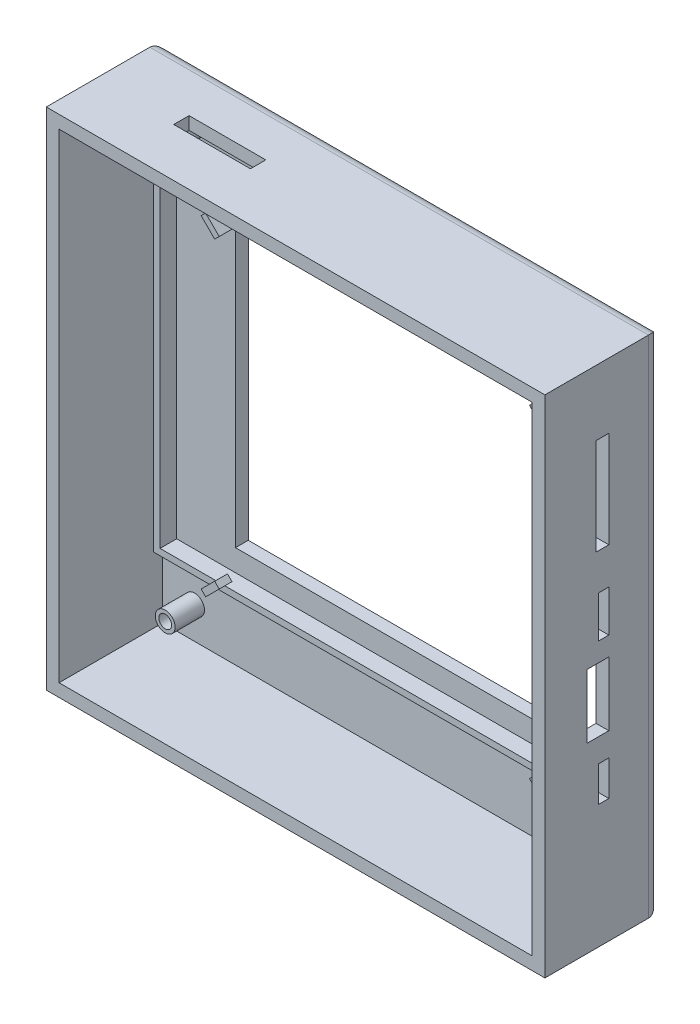
from build123d import *

# Parameters (mm, degrees)
SKETCH_876_W           = 78
SKETCH_876_H           = 79
EXTRUDE_1660_DEPTH     = 18.2
SKETCH_1708_W          = 74.00014986
SKETCH_1708_H          = 75.0001524
SKETCH_1708_W_2        = 69.2
SKETCH_1708_H_2        = 50
SKETCH_1708_W_3        = 57.6
SKETCH_1708_H_3        = 43.2
LCD_DEPTH              = 2
LCD_2_OUTLINE_W        = 71.5
LCD_2_OUTLINE_H        = 52
LCD_2_OUTLINE_W_2      = 69.5
LCD_2_OUTLINE_H_2      = 50
LCD_2_DEPTH            = 2.6
LCD_3_DEPTH            = 2
SKETCH_9_R             = 1.55
SKETCH_9_R_2           = 1.00000254
PCB_DEPTH              = 4.6
USB_START              = 74.00015
SKETCH_11_W            = 1.6
SKETCH_11_H            = 5.5
SKETCH_11_W_2          = 3.4
SKETCH_11_H_2          = 10
SKETCH_11_W_3          = 2
SKETCH_11_H_3          = 15.11
SKETCH_11_H_4          = 6.51
USB_DEPTH              = 1.999925
CUT_EXTRUDE_7042_REACH = 91.005
SKETCH_12_W            = 12
SKETCH_12_H            = 2.4
FILLET_1_R             = 2


# Read off the part's stored shape, not the designer's step: LCD边框
with BuildPart() as part:
    # Sketch 876 → Extrude 1660 (new body)
    with BuildSketch(Plane.XY):
        with Locations((1.76392246, -1.007858704)):
            Rectangle(SKETCH_876_W, SKETCH_876_H)
        Polygon((-17.23611691, -38.507858704), (-14.23610929, -38.507858704), (38.76399739, -38.507858704), (38.76399739, -20.507823144), (38.76399739, 15.492250516), (38.76399739, 36.492293696), (-35.23615247, 36.492293696), (-35.23615247, -38.507858704), align=None, mode=Mode.SUBTRACT)
    extrude(amount=-EXTRUDE_1660_DEPTH)

    # Sketch 1708 → LCD (add)
    # profile 1 of 2: a face of its own
    with BuildSketch(Plane(origin=(0, 0, -18.2), x_dir=(-1, 0, 0), z_dir=(0, 0, -1))):
        with Locations((-1.76392246, -1.007782504)):
            Rectangle(SKETCH_1708_W, SKETCH_1708_H)
        with Locations((-1.76392246, -1.007858704)):
            Rectangle(SKETCH_1708_W_2, SKETCH_1708_H_2, mode=Mode.SUBTRACT)
    # profile 2 of 2: a face of its own
    with BuildSketch(Plane(origin=(0, 0, -18.2), x_dir=(-1, 0, 0), z_dir=(0, 0, -1))):
        with Locations((-1.76392246, -1.007858704)):
            Rectangle(SKETCH_1708_W_2, SKETCH_1708_H_2)
        with Locations((-4.96392246, -1.007858704)):
            Rectangle(SKETCH_1708_W_3, SKETCH_1708_H_3, mode=Mode.SUBTRACT)
    extrude(amount=-LCD_DEPTH)

    # LCD 2 outline → LCD 2 (add)
    with BuildSketch(Plane.XY.offset(-16.2)):
        with Locations((1.71392246, -1.007858704)):
            Rectangle(LCD_2_OUTLINE_W, LCD_2_OUTLINE_H)
        with Locations((1.71392246, -1.007858704)):
            Rectangle(LCD_2_OUTLINE_W_2, LCD_2_OUTLINE_H_2, mode=Mode.SUBTRACT)
    extrude(amount=LCD_2_DEPTH)

    # 草图7 → LCD 3 (add)
    with BuildSketch(Plane.XY.offset(-13.6)):
        Polygon((-23.904159925, -27.007858704), (-21.782839581, -24.886538361), (-22.489946362, -24.17943158), (-24.611266706, -26.300751923), align=None)
        Polygon((27.461068732, -27.007858704), (29.582389075, -24.886538361), (28.875282294, -24.17943158), (26.75396195, -26.300751923), align=None)
        Polygon((26.75396195, 24.285034514), (28.875282294, 22.163714171), (29.582389075, 22.870820952), (27.461068732, 24.992141296), align=None)
        Polygon((-24.611266706, 24.285034514), (-22.489946362, 22.163714171), (-21.782839581, 22.870820952), (-23.904159925, 24.992141296), align=None)
    extrude(amount=LCD_3_DEPTH)

    # 草图9 → PCB螺丝位 (add)
    # profile 1 of 4: a face of its own
    with BuildSketch(Plane.XY.offset(-16.2)):
        with Locations(Location((-30.179759278, 31.492141296, 0), (0, 0, 180))):
            Circle(SKETCH_9_R)
        with Locations(Location((-30.179759278, 31.492141296, 0), (0, 0, 180))):
            Circle(SKETCH_9_R_2, mode=Mode.SUBTRACT)
    # profile 2 of 4: a face of its own
    with BuildSketch(Plane.XY.offset(-16.2)):
        with Locations(Location((33.76398723, 31.492283536, 0), (0, 0, 180))):
            Circle(SKETCH_9_R)
        with Locations(Location((33.76398723, 31.492283536, 0), (0, 0, 180))):
            Circle(SKETCH_9_R_2, mode=Mode.SUBTRACT)
    # profile 3 of 4: a face of its own
    with BuildSketch(Plane.XY.offset(-16.2)):
        with Locations(Location((33.76398723, -33.507848544, 0), (0, 0, 180))):
            Circle(SKETCH_9_R)
        with Locations(Location((33.76398723, -33.507848544, 0), (0, 0, 180))):
            Circle(SKETCH_9_R_2, mode=Mode.SUBTRACT)
    # profile 4 of 4: a face of its own
    with BuildSketch(Plane.XY.offset(-16.2)):
        with Locations(Location((-30.23614231, -33.507848544, 0), (0, 0, 180))):
            Circle(SKETCH_9_R)
        with Locations(Location((-30.23614231, -33.507848544, 0), (0, 0, 180))):
            Circle(SKETCH_9_R_2, mode=Mode.SUBTRACT)
    extrude(amount=PCB_DEPTH)

    # 草图11 → 切除-USB边 (cut)
    with BuildSketch(Plane(origin=(-35.23615247, 0, 0), x_dir=(0, 0, -1), z_dir=(1, 0, 0)).offset(USB_START)):
        with Locations((9.2, -18.437706304)):
            Rectangle(SKETCH_11_W, SKETCH_11_H)
        with Locations((8.3, -7.007706304)):
            Rectangle(SKETCH_11_W_2, SKETCH_11_H_2)
        with Locations((9, 20.737293696)):
            Rectangle(SKETCH_11_W_3, SKETCH_11_H_3)
        with Locations((9.2, 4.207293696)):
            Rectangle(SKETCH_11_W, SKETCH_11_H_4)
    extrude(amount=USB_DEPTH, mode=Mode.SUBTRACT)

    # 草图12 → Cut-Extrude 7042 (cut, up to next)
    with BuildSketch(Plane.XZ.offset(-36.492293696), mode=Mode.PRIVATE) as cut_extrude_7042_sk1:
        with Locations((-18.89615247, -8.8)):
            Rectangle(SKETCH_12_W, SKETCH_12_H)
    cut_extrude_7042_tool1 = extrude(cut_extrude_7042_sk1.sketch, amount=-CUT_EXTRUDE_7042_REACH, mode=Mode.PRIVATE) & part.part
    add(cut_extrude_7042_tool1.solids().sort_by_distance((-18.896152, 36.492294, -8.8))[0], mode=Mode.SUBTRACT)

    # 圆角1
    fillet_1_edges = [part.edges().sort_by_distance(p)[0] for p in [
        (-37.23607754, -1.007858704, -18.2),
        (1.76392246, -40.507858704, -18.2),
        (40.76392246, -1.007858704, -18.2),
        (1.76392246, 38.492141296, -18.2),
    ]]
    fillet(fillet_1_edges, radius=FILLET_1_R)


solid = part.part
